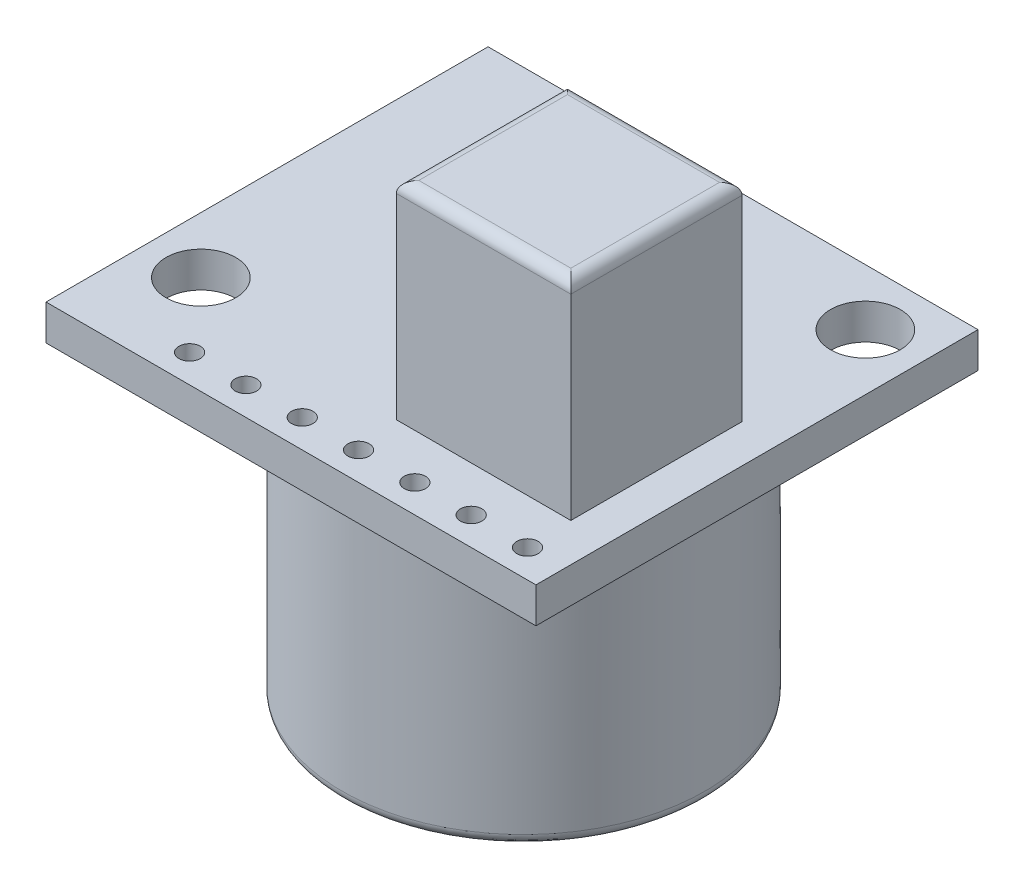
from build123d import *

# Parameters (mm, degrees)
SKETCH1_W           = 22.098
SKETCH1_H           = 19.939
SKETCH1_R           = 1.5748
SKETCH1_R_2         = 0.4826
BOSS_EXTRUDE1_DEPTH = 1.6002
SKETCH2_W           = 7.874
SKETCH2_H           = 7.7216
BOSS_EXTRUDE2_DEPTH = 9.3472
SKETCH7_R           = 8.1915
BOSS_EXTRUDE6_DEPTH = 13.6398
SKETCH8_W           = 4.572
SKETCH8_H           = 6.604
BOSS_EXTRUDE7_DEPTH = 2.032
FILLET2_R           = 0.508
FILLET3_R           = 0.508


with BuildPart() as part:
    # Sketch1 → Boss-Extrude1 (new body)
    with BuildSketch(Plane(origin=(0, 0, 0), x_dir=(1, 0, 0), z_dir=(0, 1, 0))):
        Rectangle(SKETCH1_W, SKETCH1_H)
        with Locations((8.509, 7.4295)):
            Circle(SKETCH1_R, mode=Mode.SUBTRACT)
        with Locations((-8.509, -5.5245)):
            Circle(SKETCH1_R, mode=Mode.SUBTRACT)
        with Locations((9.398, -8.6995)):
            Circle(SKETCH1_R_2, mode=Mode.SUBTRACT)
        with Locations((6.858, -8.6995)):
            Circle(SKETCH1_R_2, mode=Mode.SUBTRACT)
        with Locations((4.318, -8.6995)):
            Circle(SKETCH1_R_2, mode=Mode.SUBTRACT)
        with Locations((1.778, -8.6995)):
            Circle(SKETCH1_R_2, mode=Mode.SUBTRACT)
        with Locations((-0.762, -8.6995)):
            Circle(SKETCH1_R_2, mode=Mode.SUBTRACT)
        with Locations((-3.302, -8.6995)):
            Circle(SKETCH1_R_2, mode=Mode.SUBTRACT)
        with Locations((-5.842, -8.6995)):
            Circle(SKETCH1_R_2, mode=Mode.SUBTRACT)
    extrude(amount=BOSS_EXTRUDE1_DEPTH)

    # Sketch2 → Boss-Extrude2 (add)
    with BuildSketch(Plane(origin=(0, 1.6002, 0), x_dir=(1, 0, 0), z_dir=(0, 1, 0))):
        with Locations((5.3848, -2.8067)):
            Rectangle(SKETCH2_W, SKETCH2_H)
    extrude(amount=BOSS_EXTRUDE2_DEPTH)

    # Sketch7 → Boss-Extrude6 (add)
    with BuildSketch(Plane.XZ):
        with Locations((0, -0.5207)):
            Circle(SKETCH7_R)
    extrude(amount=BOSS_EXTRUDE6_DEPTH)

    # Sketch8 → Boss-Extrude7 (add)
    with BuildSketch(Plane.XZ):
        with Locations((-8.255, -4.6355)):
            Rectangle(SKETCH8_W, SKETCH8_H)
    extrude(amount=BOSS_EXTRUDE7_DEPTH)

    # Fillet2
    fillet2_edges = [part.edges().sort_by_distance(p)[0] for p in [
        (-8.1915, -13.6398, -0.5207),
    ]]
    fillet(fillet2_edges, radius=FILLET2_R)

    # Fillet3
    fillet3_edges = [part.edges().sort_by_distance(p)[0] for p in [
        (5.3848, 10.9474, -1.0541),
        (1.4478, 10.9474, 2.8067),
        (5.3848, 10.9474, 6.6675),
        (9.3218, 10.9474, 2.8067),
    ]]
    fillet(fillet3_edges, radius=FILLET3_R)


solid = part.part
